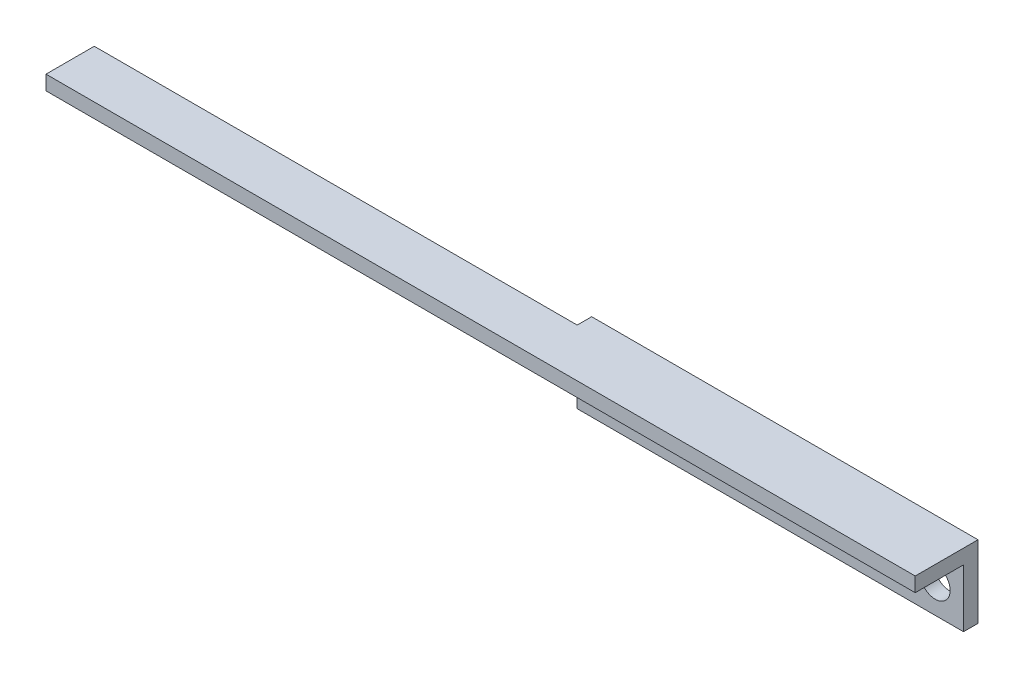
from build123d import *

# Parameters (mm, degrees)
SKETCH_1_W      = 40
SKETCH_1_H      = 6
SKETCH_1_R      = 1.55
EXTRUDE_1_DEPTH = 1.5
SKETCH_2_W      = 40
SKETCH_2_H      = 1.5
EXTRUDE_2_DEPTH = 1.5
SKETCH_4_W      = 40
SKETCH_4_H      = 1.5
EXTRUDE_4_DEPTH = 6.5
SKETCH_6_W      = 5
SKETCH_6_H      = 1.5
EXTRUDE_5_DEPTH = 50


with BuildPart() as part:
    # 草图1 → 凸台-拉伸1 (new body)
    with BuildSketch(Plane.XY):
        Rectangle(SKETCH_1_W, SKETCH_1_H)
        with Locations((-17.066, 0)):
            Circle(SKETCH_1_R, mode=Mode.SUBTRACT)
        with Locations((17.066, 0)):
            Circle(SKETCH_1_R, mode=Mode.SUBTRACT)
    extrude(amount=EXTRUDE_1_DEPTH)

    # 草图2 → 凸台-拉伸2 (add)
    with BuildSketch(Plane(origin=(0, 3, 0), x_dir=(1, 0, 0), z_dir=(0, 1, 0))):
        with Locations((0, -0.75)):
            Rectangle(SKETCH_2_W, SKETCH_2_H)
    extrude(amount=EXTRUDE_2_DEPTH)

    # 草图4 → 凸台-拉伸4 (add)
    with BuildSketch(Plane(origin=(0, 0, 0), x_dir=(-1, 0, 0), z_dir=(0, 0, -1))):
        with Locations((0, 3.75)):
            Rectangle(SKETCH_4_W, SKETCH_4_H)
    extrude(amount=-EXTRUDE_4_DEPTH)

    # 草图6 → 凸台-拉伸5 (add)
    with BuildSketch(Plane.ZY.offset(20)):
        with Locations((4, 3.75)):
            Rectangle(SKETCH_6_W, SKETCH_6_H)
    extrude(amount=EXTRUDE_5_DEPTH)


solid = part.part
